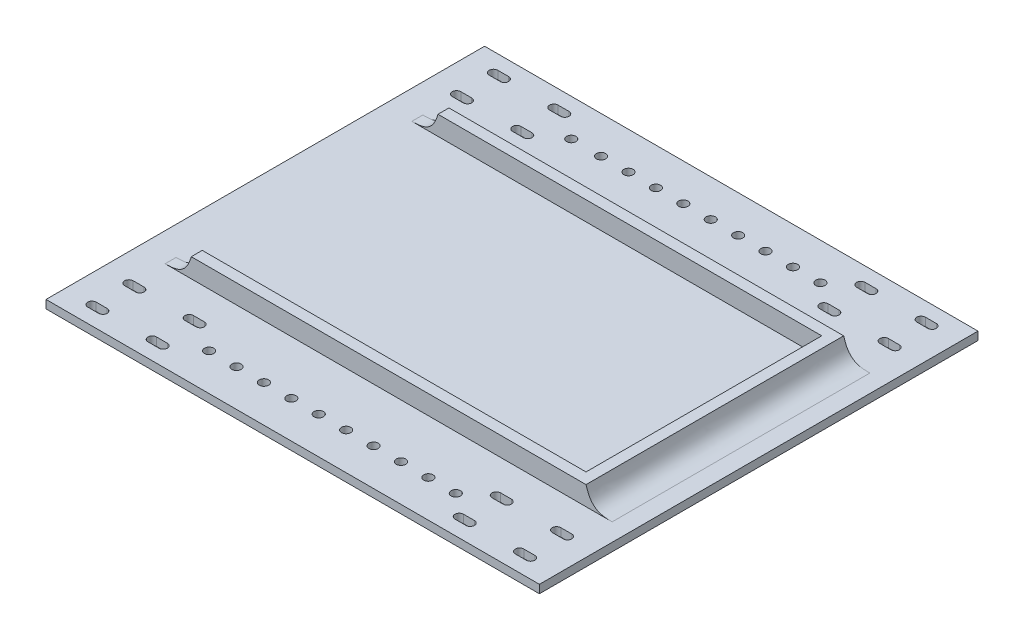
from build123d import *

# Parameters (mm, degrees)
SKETCH1_W            = 180
SKETCH1_H            = 160
BOSS_EXTRUDE1_DEPTH  = 3
BOSS_EXTRUDE2_DEPTH  = 10
FILLET1_START        = -47
FILLET1_DEPTH        = 94
FILLET1_2_DEPTH      = 4
FILLET1_START_2      = 43
FILLET1_3_DEPTH      = 4
M3_CLEARANCE_HOLE1_D = 3.4


with BuildPart() as part:
    # Sketch1 → Boss-Extrude1 (new body)
    with BuildSketch(Plane(origin=(0, 0, 0), x_dir=(1, 0, 0), z_dir=(0, 1, 0))):
        Rectangle(SKETCH1_W, SKETCH1_H)
        with BuildLine():
            Line((-80, -58.195), (-76, -58.195))
            ThreePointArc((-76, -58.195), (-74.445, -59.75), (-76, -61.305))
            Line((-76, -61.305), (-80, -61.305))
            ThreePointArc((-80, -61.305), (-81.555, -59.75), (-80, -58.195))
        make_face(mode=Mode.SUBTRACT)
        with BuildLine():
            Line((-58, -58.195), (-54, -58.195))
            ThreePointArc((-54, -58.195), (-52.445, -59.75), (-54, -61.305))
            Line((-54, -61.305), (-58, -61.305))
            ThreePointArc((-58, -61.305), (-59.555, -59.75), (-58, -58.195))
        make_face(mode=Mode.SUBTRACT)
        with BuildLine():
            Line((-80, -71.695), (-76, -71.695))
            ThreePointArc((-76, -71.695), (-74.445, -73.25), (-76, -74.805))
            Line((-76, -74.805), (-80, -74.805))
            ThreePointArc((-80, -74.805), (-81.555, -73.25), (-80, -71.695))
        make_face(mode=Mode.SUBTRACT)
        with BuildLine():
            Line((-58, -71.695), (-54, -71.695))
            ThreePointArc((-54, -71.695), (-52.445, -73.25), (-54, -74.805))
            Line((-54, -74.805), (-58, -74.805))
            ThreePointArc((-58, -74.805), (-59.555, -73.25), (-58, -71.695))
        make_face(mode=Mode.SUBTRACT)
        with BuildLine():
            Line((-80, 71.695), (-76, 71.695))
            ThreePointArc((-76, 71.695), (-74.445, 73.25), (-76, 74.805))
            Line((-76, 74.805), (-80, 74.805))
            ThreePointArc((-80, 74.805), (-81.555, 73.25), (-80, 71.695))
        make_face(mode=Mode.SUBTRACT)
        with BuildLine():
            Line((-58, 71.695), (-54, 71.695))
            ThreePointArc((-54, 71.695), (-52.445, 73.25), (-54, 74.805))
            Line((-54, 74.805), (-58, 74.805))
            ThreePointArc((-58, 74.805), (-59.555, 73.25), (-58, 71.695))
        make_face(mode=Mode.SUBTRACT)
        with BuildLine():
            Line((-58, 58.195), (-54, 58.195))
            ThreePointArc((-54, 58.195), (-52.445, 59.75), (-54, 61.305))
            Line((-54, 61.305), (-58, 61.305))
            ThreePointArc((-58, 61.305), (-59.555, 59.75), (-58, 58.195))
        make_face(mode=Mode.SUBTRACT)
        with BuildLine():
            Line((-80, 58.195), (-76, 58.195))
            ThreePointArc((-76, 58.195), (-74.445, 59.75), (-76, 61.305))
            Line((-76, 61.305), (-80, 61.305))
            ThreePointArc((-80, 61.305), (-81.555, 59.75), (-80, 58.195))
        make_face(mode=Mode.SUBTRACT)
        with BuildLine():
            Line((80, -71.695), (76, -71.695))
            ThreePointArc((76, -71.695), (74.445, -73.25), (76, -74.805))
            Line((76, -74.805), (80, -74.805))
            ThreePointArc((80, -74.805), (81.555, -73.25), (80, -71.695))
        make_face(mode=Mode.SUBTRACT)
        with BuildLine():
            Line((80, -58.195), (76, -58.195))
            ThreePointArc((76, -58.195), (74.445, -59.75), (76, -61.305))
            Line((76, -61.305), (80, -61.305))
            ThreePointArc((80, -61.305), (81.555, -59.75), (80, -58.195))
        make_face(mode=Mode.SUBTRACT)
        with BuildLine():
            Line((58, -58.195), (54, -58.195))
            ThreePointArc((54, -58.195), (52.445, -59.75), (54, -61.305))
            Line((54, -61.305), (58, -61.305))
            ThreePointArc((58, -61.305), (59.555, -59.75), (58, -58.195))
        make_face(mode=Mode.SUBTRACT)
        with BuildLine():
            Line((58, -71.695), (54, -71.695))
            ThreePointArc((54, -71.695), (52.445, -73.25), (54, -74.805))
            Line((54, -74.805), (58, -74.805))
            ThreePointArc((58, -74.805), (59.555, -73.25), (58, -71.695))
        make_face(mode=Mode.SUBTRACT)
        with BuildLine():
            Line((80, 58.195), (76, 58.195))
            ThreePointArc((76, 58.195), (74.445, 59.75), (76, 61.305))
            Line((76, 61.305), (80, 61.305))
            ThreePointArc((80, 61.305), (81.555, 59.75), (80, 58.195))
        make_face(mode=Mode.SUBTRACT)
        with BuildLine():
            Line((58, 58.195), (54, 58.195))
            ThreePointArc((54, 58.195), (52.445, 59.75), (54, 61.305))
            Line((54, 61.305), (58, 61.305))
            ThreePointArc((58, 61.305), (59.555, 59.75), (58, 58.195))
        make_face(mode=Mode.SUBTRACT)
        with BuildLine():
            Line((58, 71.695), (54, 71.695))
            ThreePointArc((54, 71.695), (52.445, 73.25), (54, 74.805))
            Line((54, 74.805), (58, 74.805))
            ThreePointArc((58, 74.805), (59.555, 73.25), (58, 71.695))
        make_face(mode=Mode.SUBTRACT)
        with BuildLine():
            Line((80, 71.695), (76, 71.695))
            ThreePointArc((76, 71.695), (74.445, 73.25), (76, 74.805))
            Line((76, 74.805), (80, 74.805))
            ThreePointArc((80, 74.805), (81.555, 73.25), (80, 71.695))
        make_face(mode=Mode.SUBTRACT)
    extrude(amount=BOSS_EXTRUDE1_DEPTH)

    # Sketch1<3> → Boss-Extrude2 (add)
    with BuildSketch(Plane(origin=(0, 0, 0), x_dir=(1, 0, 0), z_dir=(0, 1, 0))):
        Polygon((-70, 47), (-70, 43), (70, 43), (70, -43), (-70, -43), (-70, -47), (74, -47), (74, 47), align=None)
    extrude(amount=BOSS_EXTRUDE2_DEPTH)

    # Fillet1: read off the stored shape, not the designer's step
    # Fillet1 outline → Fillet1 (add)
    with BuildSketch(Plane.XY.offset(FILLET1_START)):
        with BuildLine():
            Line((74, 10), (74, 3))
            Line((74, 3), (83.539392014, 3))
            add(Edge.make_bspline(
                [(83.539392014, 3), (82.252081476, 3), (80.964770938, 3), (78.099649509, 3.423086243), (76.035521304, 4.937742252), (74.772386323, 7.543968027), (74.386193161, 8.771984013), (74, 10)],
                knots=[0, 0, 0, 0, 0, 0, 0.5, 0.5, 1, 1, 1, 1, 1, 1], degree=5))
        make_face()
    extrude(amount=FILLET1_DEPTH)

    # Fillet1 2 outline → Fillet1 2 (add)
    with BuildSketch(Plane.XY.offset(FILLET1_START)):
        with BuildLine():
            add(Edge.make_bspline(
                [(-79.539392014, 3), (-78.252081476, 3), (-76.964770938, 3), (-74.099649509, 3.423086243), (-72.035521304, 4.937742252), (-70.772386323, 7.543968027), (-70.386193161, 8.771984013), (-70, 10)],
                knots=[0, 0, 0, 0, 0, 0, 0.5, 0.5, 1, 1, 1, 1, 1, 1], degree=5))
            Line((-79.539392014, 3), (-70, 3))
            Line((-70, 3), (-70, 10))
        make_face()
    extrude(amount=FILLET1_2_DEPTH)

    # Fillet1 3 outline → Fillet1 3 (add)
    with BuildSketch(Plane.XY.offset(FILLET1_START_2)):
        with BuildLine():
            add(Edge.make_bspline(
                [(-79.539392014, 3), (-78.252081476, 3), (-76.964770938, 3), (-74.099649509, 3.423086243), (-72.035521304, 4.937742252), (-70.772386323, 7.543968027), (-70.386193161, 8.771984013), (-70, 10)],
                knots=[0, 0, 0, 0, 0, 0, 0.5, 0.5, 1, 1, 1, 1, 1, 1], degree=5))
            Line((-79.539392014, 3), (-70, 3))
            Line((-70, 3), (-70, 10))
        make_face()
    extrude(amount=FILLET1_3_DEPTH)

    # M3 Clearance Hole1 (through all)
    with Locations(Plane(origin=(0, 3, 0), x_dir=(1, 0, 0), z_dir=(0, 1, 0))):
        with Locations((-44, -66.5), (-34, -66.5), (-24, -66.5), (-14, -66.5), (-4, -66.5), (6, -66.5), (16, -66.5), (26, -66.5), (36, -66.5), (46, -66.5), (46, 66.5), (36, 66.5), (26, 66.5), (16, 66.5), (6, 66.5), (-4, 66.5), (-14, 66.5), (-24, 66.5), (-34, 66.5), (-44.881291433, 66.5)):
            Hole(M3_CLEARANCE_HOLE1_D / 2)


solid = part.part
